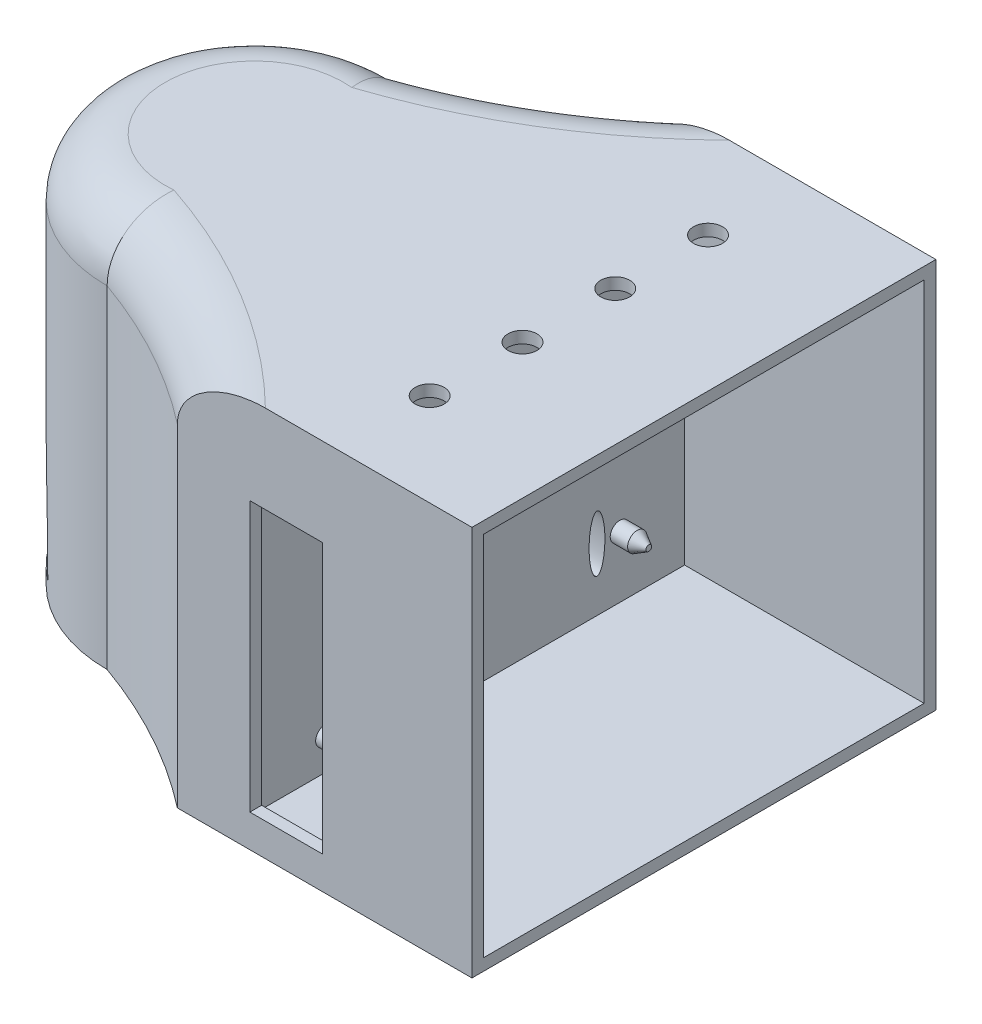
from build123d import *
from OCP.BRepFilletAPI import BRepFilletAPI_MakeChamfer

# Parameters (mm, degrees)
BOSS_EXTRUDE2_DEPTH     = 67.31
FILLET1_R               = 10
SKETCH2_W               = 75.946
SKETCH2_H               = 63.246
CUT_EXTRUDE1_DEPTH      = 41.31
SKETCH3_R               = 1.651
BOSS_EXTRUDE3_DEPTH     = 5
CHAMFER1_SIZE           = 2
CHAMFER1_SIZE2          = 1.154700538
CUT_EXTRUDE3_DEPTH      = 52
CUT_EXTRUDE4_DEPTH      = 25
CUT_EXTRUDE4_DEPTH_BACK = 25
SKETCH7_W               = 19
SKETCH7_H               = 12
SKETCH8_RX              = 4.869968375
SKETCH8_RY              = 1.367382804
CUT_EXTRUDE5_DEPTH      = 101.947236771
SKETCH5_W               = 12.523018164
SKETCH5_H               = 46.522194605
CUT_EXTRUDE6_DEPTH      = 10
SKETCH9_R               = 2.5
CUT_EXTRUDE7_DEPTH      = 10


with BuildPart() as part:
    # Sketch1 → Boss-Extrude2 (new body)
    with BuildSketch(Plane(origin=(0, 0, 0), x_dir=(1, 0, 0), z_dir=(0, 1, 0))):
        with BuildLine():
            Line((28.512569605, 26.806942292), (-22.287430395, 26.806942292))
            ThreePointArc((-22.287430395, 26.806942292), (-35.064642425, 18.429570328), (-49.016493819, 12.201942292))
            ThreePointArc((-49.016493819, 12.201942292), (-74.416493819, -13.198057708), (-49.016493819, -38.598057708))
            ThreePointArc((-49.016493819, -38.598057708), (-35.064642425, -44.825685743), (-22.287430395, -53.203057708))
            Line((-22.287430395, -53.203057708), (28.512569605, -53.203057708))
            Line((28.512569605, -53.203057708), (28.512569605, 26.806942292))
        make_face()
    extrude(amount=BOSS_EXTRUDE2_DEPTH)

    # Fillet1
    fillet1_edges = [part.edges().sort_by_distance(p)[0] for p in [
        (-35.064642425, 67.31, 44.825685743),
        (-74.416493819, 67.31, 13.198057708),
        (-35.064642425, 67.31, -18.429570328),
    ]]
    fillet(fillet1_edges, radius=FILLET1_R)

    # Sketch2 → Cut-Extrude1 (cut)
    with BuildSketch(Plane(origin=(28.512569605, 0, 0), x_dir=(0, 0, -1), z_dir=(1, 0, 0))):
        with Locations((-13.198057708, 33.655)):
            Rectangle(SKETCH2_W, SKETCH2_H)
    extrude(amount=-CUT_EXTRUDE1_DEPTH, mode=Mode.SUBTRACT)

    # Sketch3 → Boss-Extrude3 (add)
    with BuildSketch(Plane(origin=(-12.797430395, 0, 0), x_dir=(0, 0, -1), z_dir=(1, 0, 0))):
        with Locations((-37.201057708, 55.824657448)):
            Circle(SKETCH3_R)
        with Locations((-37.201057708, 7.564657448)):
            Circle(SKETCH3_R)
        with Locations((13.598942292, 40.584657448)):
            Circle(SKETCH3_R)
        with Locations((13.598942292, 12.644657448)):
            Circle(SKETCH3_R)
    extrude(amount=BOSS_EXTRUDE3_DEPTH)

    # Chamfer1: one chamfer whose edges measure the first distance from different faces: ONE call of the kernel's chamfer builder (chamfer() names one face for all edges)
    chamfer1_edges_1 = [part.edges().sort_by_distance(p)[0] for p in [
        (-7.797430395, 12.644657448, -11.947942292),
    ]]
    chamfer1_side_1 = [part.faces().sort_by_distance(p)[0] for p in [
        (-10.297430395, 12.644657448, -11.947942292),
    ]]
    chamfer1_edges_2 = [part.edges().sort_by_distance(p)[0] for p in [
        (-7.797430395, 40.584657448, -11.947942292),
    ]]
    chamfer1_side_2 = [part.faces().sort_by_distance(p)[0] for p in [
        (-10.297430395, 40.584657448, -11.947942292),
    ]]
    chamfer1_edges_3 = [part.edges().sort_by_distance(p)[0] for p in [
        (-7.797430395, 55.824657448, 38.852057708),
    ]]
    chamfer1_side_3 = [part.faces().sort_by_distance(p)[0] for p in [
        (-10.297430395, 55.824657448, 38.852057708),
    ]]
    chamfer1_edges_4 = [part.edges().sort_by_distance(p)[0] for p in [
        (-7.797430395, 7.564657448, 38.852057708),
    ]]
    chamfer1_side_4 = [part.faces().sort_by_distance(p)[0] for p in [
        (-10.297430395, 7.564657448, 38.852057708),
    ]]
    chamfer1 = BRepFilletAPI_MakeChamfer(part.part.solid().wrapped)
    for e in chamfer1_edges_1:
        chamfer1.Add(CHAMFER1_SIZE, CHAMFER1_SIZE2, e.wrapped, chamfer1_side_1[0].wrapped)  # the first distance lies on this face
    for e in chamfer1_edges_2:
        chamfer1.Add(CHAMFER1_SIZE, CHAMFER1_SIZE2, e.wrapped, chamfer1_side_2[0].wrapped)  # the first distance lies on this face
    for e in chamfer1_edges_3:
        chamfer1.Add(CHAMFER1_SIZE, CHAMFER1_SIZE2, e.wrapped, chamfer1_side_3[0].wrapped)  # the first distance lies on this face
    for e in chamfer1_edges_4:
        chamfer1.Add(CHAMFER1_SIZE, CHAMFER1_SIZE2, e.wrapped, chamfer1_side_4[0].wrapped)  # the first distance lies on this face
    add(Compound.cast(chamfer1.Shape()), mode=Mode.REPLACE)

    # Sketch4 → Cut-Extrude3 (cut)
    with BuildSketch(Plane(origin=(-76.2, 0, 0), x_dir=(0, 0, -1), z_dir=(1, 0, 0))):
        with BuildLine():
            Line((6.890730221, 2.888701934), (-33.286845636, 2.888701934))
            add(Edge.make_bspline(
                [(6.890730221, 2.888701934), (6.890730221, 51.375976578), (-13.198057708, 51.375976578), (-33.286845636, 51.375976578), (-33.286845636, 2.888701934)],
                knots=[4.71238898, 4.71238898, 4.71238898, 6.283185307, 6.283185307, 7.853981634, 7.853981634, 7.853981634], degree=2, weights=[1, 0.707106781, 1, 0.707106781, 1]))
        make_face()
    extrude(amount=CUT_EXTRUDE3_DEPTH, mode=Mode.SUBTRACT)

    # Sketch7 → Cut-Extrude4 (cut, two sides: drawn at the far end of the back side and taken through both)
    with BuildSketch(Plane.XY.offset(13.198057708).offset(-CUT_EXTRUDE4_DEPTH_BACK)):
        with Locations((-34.177120444, 12.926995259)):
            Rectangle(SKETCH7_W, SKETCH7_H)
    extrude(amount=CUT_EXTRUDE4_DEPTH + CUT_EXTRUDE4_DEPTH_BACK, mode=Mode.SUBTRACT)

    # Sketch8 → Cut-Extrude5 (cut, through all)
    with BuildSketch(Plane.ZY.offset(24.677120444)):
        with Locations(Location((-9.66538742, 12.775075764), (0, 0, -90))):
            Ellipse(SKETCH8_RX, SKETCH8_RY)
        with Locations(Location((35.24218315, 12.775075764), (0, 0, -90))):
            Ellipse(SKETCH8_RX, SKETCH8_RY)
    extrude(amount=-CUT_EXTRUDE5_DEPTH, mode=Mode.SUBTRACT)

    # Sketch5 → Cut-Extrude6 (cut)
    with BuildSketch(Plane.XY.offset(53.203057708)):
        with Locations((-3.535921313, 28.885508059)):
            Rectangle(SKETCH5_W, SKETCH5_H)
    extrude(amount=-CUT_EXTRUDE6_DEPTH, mode=Mode.SUBTRACT)

    # Sketch9 → Cut-Extrude7 (cut)
    with BuildSketch(Plane(origin=(0, 67.31, 0), x_dir=(1, 0, 0), z_dir=(0, 1, 0))):
        with Locations((5.210711632, -37.193057708)):
            Circle(SKETCH9_R)
        with Locations((5.210711632, -21.193057708)):
            Circle(SKETCH9_R)
        with Locations((5.210711632, -5.193057708)):
            Circle(SKETCH9_R)
        with Locations((5.210711632, 10.806942292)):
            Circle(SKETCH9_R)
    extrude(amount=-CUT_EXTRUDE7_DEPTH, mode=Mode.SUBTRACT)


solid = part.part
